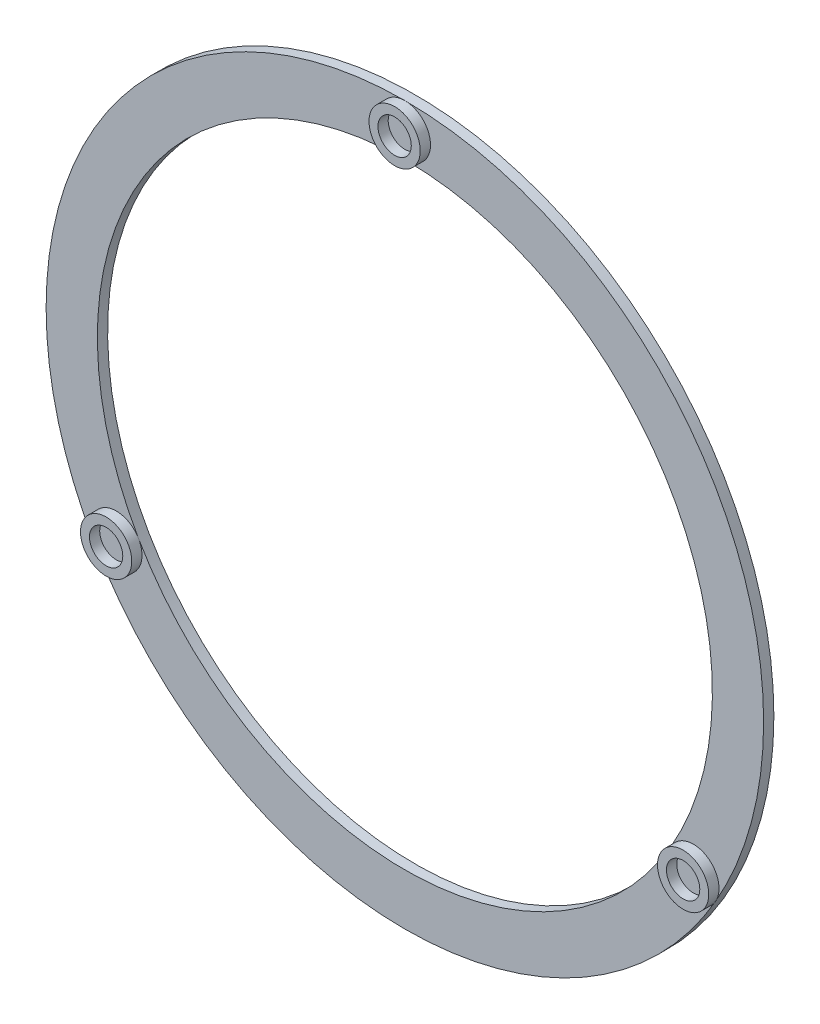
from build123d import *

# Parameters (mm, degrees)
SKETCH1_R           = 350
SKETCH1_R_2         = 300
BOSS_EXTRUDE1_DEPTH = 10
SKETCH2_R           = 25
SKETCH2_R_2         = 16.25
BOSS_EXTRUDE2_DEPTH = 10


with BuildPart() as part:
    # Sketch1 → Boss-Extrude1 (new body)
    with BuildSketch(Plane.XY):
        Circle(SKETCH1_R)
        Circle(SKETCH1_R_2, mode=Mode.SUBTRACT)
    extrude(amount=BOSS_EXTRUDE1_DEPTH)

    # Sketch2 → Boss-Extrude2 (add)
    # profile 1 of 3: a face of its own
    with BuildSketch(Plane.XY.offset(10)):
        with Locations((0, 325)):
            Circle(SKETCH2_R)
        with Locations((0, 325)):
            Circle(SKETCH2_R_2, mode=Mode.SUBTRACT)
    # profile 2 of 3: a face of its own
    with BuildSketch(Plane.XY.offset(10)):
        with Locations((281.45825623, -162.5)):
            Circle(SKETCH2_R)
        with Locations((281.45825623, -162.5)):
            Circle(SKETCH2_R_2, mode=Mode.SUBTRACT)
    # profile 3 of 3: a face of its own
    with BuildSketch(Plane.XY.offset(10)):
        with Locations((-281.45825623, -162.5)):
            Circle(SKETCH2_R)
        with Locations((-281.45825623, -162.5)):
            Circle(SKETCH2_R_2, mode=Mode.SUBTRACT)
    extrude(amount=BOSS_EXTRUDE2_DEPTH)


solid = part.part
